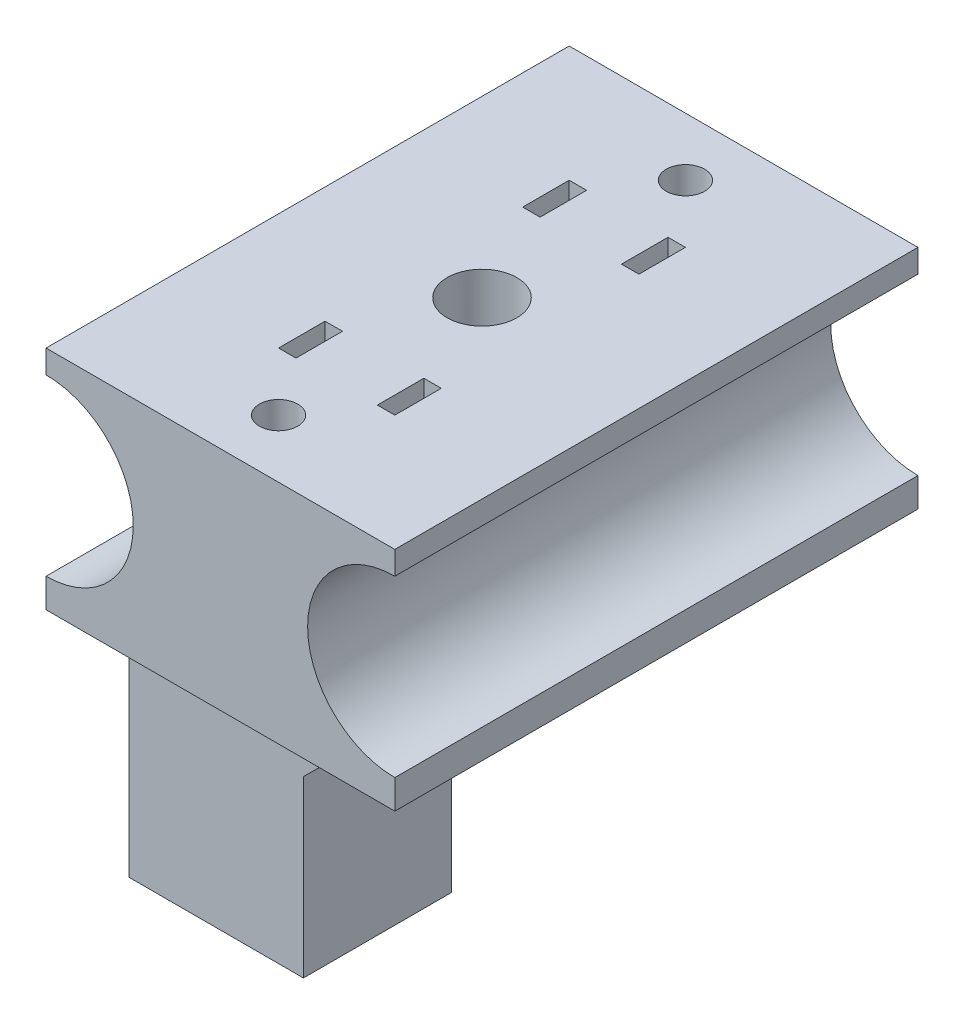
from build123d import *

# Parameters (mm, degrees)
BOSS_EXTRUDE1_DEPTH       = 22.5
M4X0_7_TAPPED_HOLE2_D     = 3.3
BOSS_EXTRUDE3_DEPTH       = 6.3625
M4X0_7_TAPPED_HOLE1_D     = 3.3
M4X0_7_TAPPED_HOLE1_DEPTH = 10
M4X0_7_TAPPED_HOLE1_TIP   = 0.991420021
CUT_EXTRUDE2_DEPTH        = 85
SKETCH2_R                 = 3
CUT_EXTRUDE1_DEPTH        = 50
CUT_EXTRUDE3_START        = -10
CUT_EXTRUDE3_DEPTH        = 4


with BuildPart() as part:
    # Sketch1 → Boss-Extrude1 (new, symmetric)
    with BuildSketch(Plane.XY):
        with BuildLine():
            Line((-15, 7.5), (-15, 9.5))
            Line((-15, 9.5), (15, 9.5))
            Line((15, 9.5), (15, 7.5))
            ThreePointArc((15, 7.5), (7.5, 0), (15, -7.5))
            Line((15, -7.5), (15, -10))
            Line((15, -10), (-15, -10))
            Line((-15, -10), (-15, -7.5))
            ThreePointArc((-15, -7.5), (-7.5, 0), (-15, 7.5))
        make_face()
    extrude(amount=BOSS_EXTRUDE1_DEPTH, both=True)

    # M4x0.7 Tapped Hole2 (through all)
    with Locations(Plane(origin=(0, -10, 0), x_dir=(-1, 0, 0), z_dir=(0, -1, 0))):
        with Locations((0, -17.5), (0, 17.5)):
            Hole(M4X0_7_TAPPED_HOLE2_D / 2)

    # Sketch7 → Boss-Extrude3 (add, symmetric)
    with BuildSketch(Plane.XY):
        Polygon((-15, -7.5), (-24, -7.5), (-24, -42.5), (-9, -42.5), (-9, -27.5), (8.5, -10), (-15, -10), align=None)
    extrude(amount=BOSS_EXTRUDE3_DEPTH, both=True)

    # M4x0.7 Tapped Hole1
    with Locations(Plane(origin=(-24, 0, 0), x_dir=(0, 0, -1), z_dir=(-1, 0, 0))):
        with Locations((0, 37.5), (0, 22.5)):
            Hole(M4X0_7_TAPPED_HOLE1_D / 2, depth=M4X0_7_TAPPED_HOLE1_DEPTH)
            with Locations((0, 0, -(M4X0_7_TAPPED_HOLE1_DEPTH + M4X0_7_TAPPED_HOLE1_TIP / 2))):  # 118° drill point
                Cone(0, M4X0_7_TAPPED_HOLE1_D / 2, M4X0_7_TAPPED_HOLE1_TIP, mode=Mode.SUBTRACT)

    # Sketch10 → Cut-Extrude2 (cut)
    with BuildSketch(Plane(origin=(0, 0, -6.3625), x_dir=(-1, 0, 0), z_dir=(0, 0, -1))):
        Polygon((15, -10), (24, -19), (24, -7.5), (15, -7.5), align=None)
    extrude(amount=-CUT_EXTRUDE2_DEPTH, mode=Mode.SUBTRACT)

    # Sketch2 → Cut-Extrude1 (cut)
    with BuildSketch(Plane(origin=(0, 9.5, 0), x_dir=(1, 0, 0), z_dir=(0, 1, 0))):
        Circle(SKETCH2_R)
    extrude(amount=-CUT_EXTRUDE1_DEPTH, mode=Mode.SUBTRACT)

    # Sketch11 → Cut-Extrude3 (cut)
    with BuildSketch(Plane(origin=(0, 0, -22.5), x_dir=(-1, 0, 0), z_dir=(0, 0, -1)).offset(CUT_EXTRUDE3_START)):
        with BuildLine():
            Line((-3.5, 9.5), (-5, 9.5))
            Line((-5, 9.5), (-5, 0))
            ThreePointArc((-5, 0), (-7.928932188, -7.071067812), (-15, -10))
            Line((-15, -10), (-3.5, -10))
            Line((-3.5, -10), (-3.5, 9.5))
        make_face()
        with BuildLine():
            Line((5, 9.5), (3.5, 9.5))
            Line((3.5, 9.5), (3.5, -10))
            Line((3.5, -10), (15, -10))
            ThreePointArc((15, -10), (7.928932188, -7.071067812), (5, 0))
            Line((5, 0), (5, 9.5))
        make_face()
    cut_extrude3 = extrude(amount=-CUT_EXTRUDE3_DEPTH, mode=Mode.SUBTRACT)

    # Mirror1: Cut-Extrude3 across plane
    add(cut_extrude3.mirror(Plane.XY), mode=Mode.SUBTRACT)


solid = part.part
